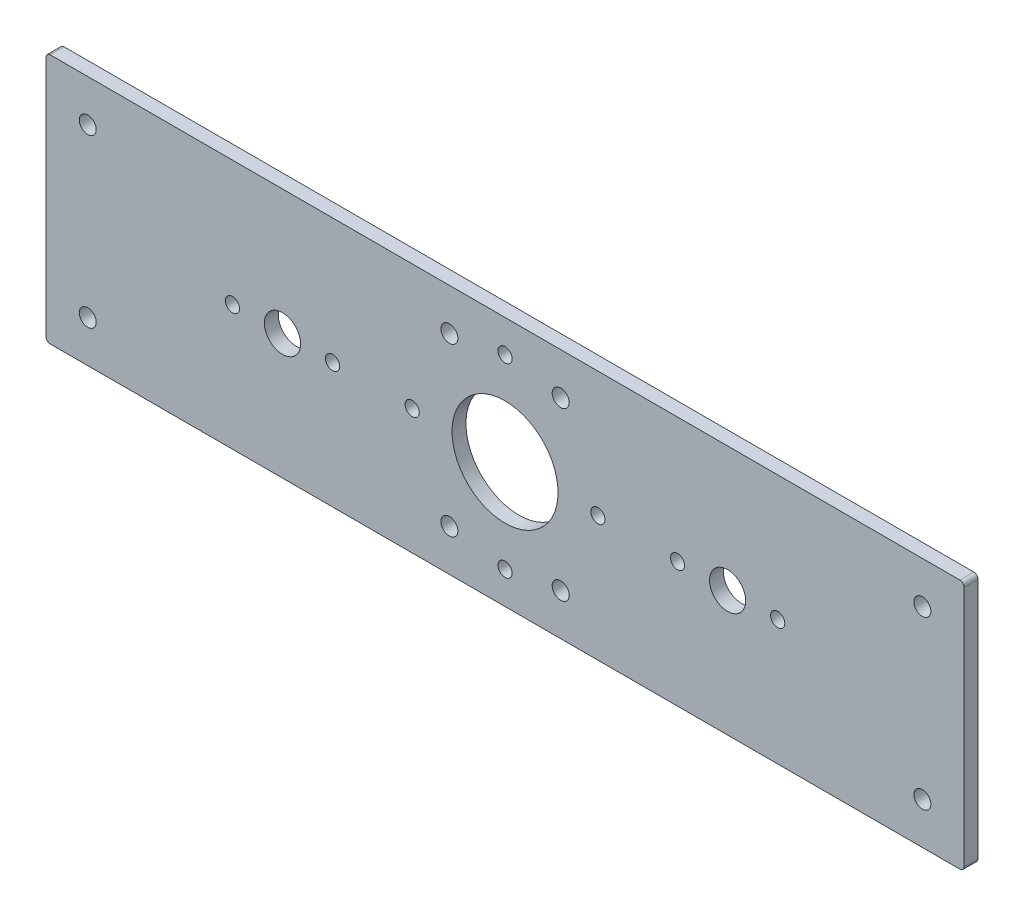
from build123d import *

# Parameters (mm, degrees)
SKETCH1_W           = 330
SKETCH1_H           = 90
SKETCH1_R           = 19.05
SKETCH1_R_2         = 2.55
BOSS_EXTRUDE1_DEPTH = 2.5
SKETCH2_R           = 3.05
CUT_EXTRUDE1_DEPTH  = 172.099386323
SKETCH3_R           = 2.55
SKETCH3_R_2         = 6.5
CUT_EXTRUDE2_DEPTH  = 172.099386323
FILLET1_R           = 1.5


with BuildPart() as part:
    # Sketch1 → Boss-Extrude1 (new, symmetric)
    with BuildSketch(Plane.XY):
        Rectangle(SKETCH1_W, SKETCH1_H)
        Circle(SKETCH1_R, mode=Mode.SUBTRACT)
        with Locations((-33.375440072, 0)):
            Circle(SKETCH1_R_2, mode=Mode.SUBTRACT)
        with Locations((33.375440072, 0)):
            Circle(SKETCH1_R_2, mode=Mode.SUBTRACT)
        with Locations((0, 33.375440072)):
            Circle(SKETCH1_R_2, mode=Mode.SUBTRACT)
        with Locations((0, -33.375440072)):
            Circle(SKETCH1_R_2, mode=Mode.SUBTRACT)
    extrude(amount=BOSS_EXTRUDE1_DEPTH, both=True)

    # Sketch2 → Cut-Extrude1 (cut, through all)
    with BuildSketch(Plane.XY.offset(2.5)):
        with Locations((-150, 30)):
            Circle(SKETCH2_R)
        with Locations((-150, -30)):
            Circle(SKETCH2_R)
        with Locations((-20, 30)):
            Circle(SKETCH2_R)
        with Locations((-20, -30)):
            Circle(SKETCH2_R)
        with Locations((20, -30)):
            Circle(SKETCH2_R)
        with Locations((20, 30)):
            Circle(SKETCH2_R)
        with Locations((150, 30)):
            Circle(SKETCH2_R)
        with Locations((150, -30)):
            Circle(SKETCH2_R)
    extrude(amount=-CUT_EXTRUDE1_DEPTH, mode=Mode.SUBTRACT)

    # Sketch3 → Cut-Extrude2 (cut, through all)
    with BuildSketch(Plane.XY.offset(2.5)):
        with Locations((-62, 0)):
            Circle(SKETCH3_R)
        with Locations((-98, 0)):
            Circle(SKETCH3_R)
        with Locations((-80, 0)):
            Circle(SKETCH3_R_2)
    cut_extrude2 = extrude(amount=-CUT_EXTRUDE2_DEPTH, mode=Mode.SUBTRACT)

    # Mirror1: Cut-Extrude2 across plane
    add(cut_extrude2.mirror(Plane(origin=(0, 0, 0), x_dir=(0, 0, 1), z_dir=(1, 0, 0))), mode=Mode.SUBTRACT)

    # Fillet1
    fillet1_edges = [part.edges().sort_by_distance(p)[0] for p in [
        (-165, -45, 0),
        (165, -45, 0),
        (165, 45, 0),
        (-165, 45, 0),
    ]]
    fillet(fillet1_edges, radius=FILLET1_R)


solid = part.part
